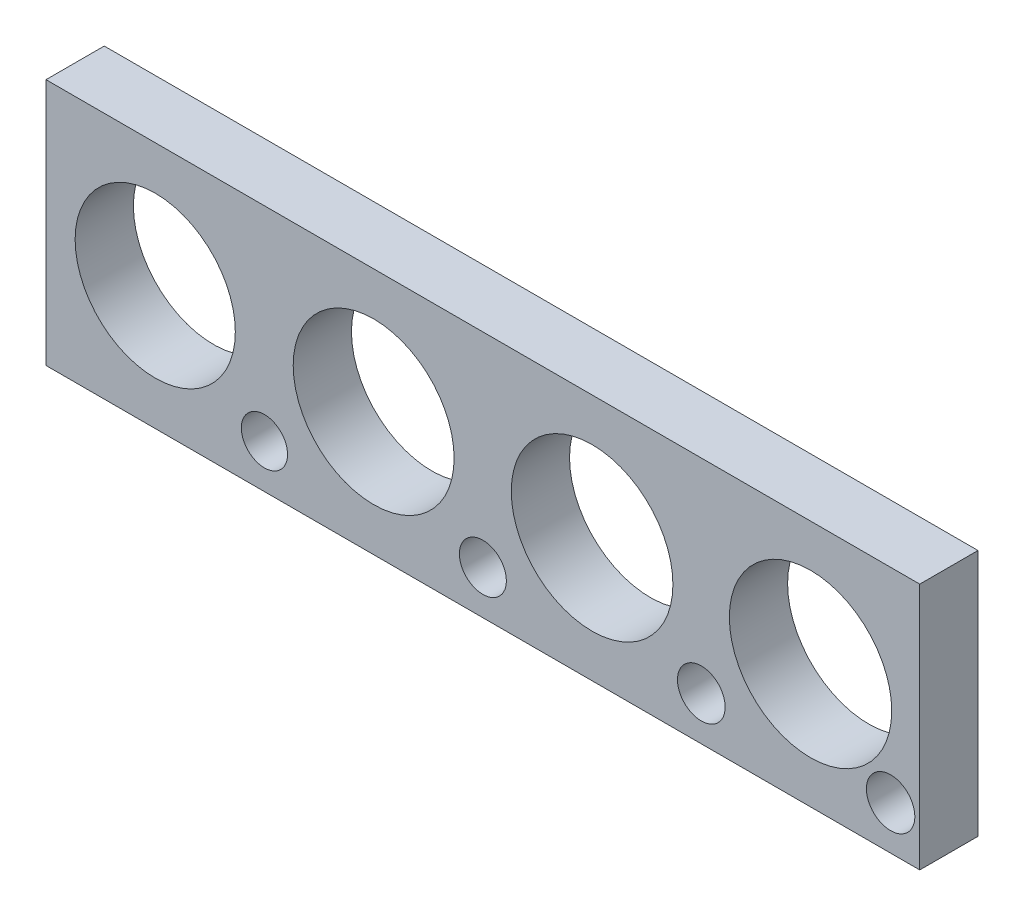
from build123d import *

# Parameters (mm, degrees)
COUPON_PLATE_PROFILE_W                     = 120
COUPON_PLATE_PROFILE_H                     = 34
COUPON_PLATE_DEPTH                         = 8
BEARING_FIT_TRIAL_THROUGH_START            = -1
BEARING_SEAT_TRIAL_22P0_22P1_22P2_22P3_R   = 11
BEARING_SEAT_TRIAL_22P0_22P1_22P2_22P3_R_2 = 11.05
BEARING_SEAT_TRIAL_22P0_22P1_22P2_22P3_R_3 = 11.1
BEARING_SEAT_TRIAL_22P0_22P1_22P2_22P3_R_4 = 11.15
BEARING_FIT_TRIAL_THROUGH_DEPTH            = 64.872887638
DOWEL_FIT_TRIAL_THROUGH_START              = -1
DOWEL_TRIAL_6P35_6P45_6P55_6P65_R          = 3.175
DOWEL_TRIAL_6P35_6P45_6P55_6P65_R_2        = 3.225
DOWEL_TRIAL_6P35_6P45_6P55_6P65_R_3        = 3.275
DOWEL_TRIAL_6P35_6P45_6P55_6P65_R_4        = 3.325
DOWEL_FIT_TRIAL_THROUGH_DEPTH              = 64.872887638


with BuildPart() as part:
    # Coupon_plate_profile → Coupon_plate (new body)
    with BuildSketch(Plane.XY):
        Rectangle(COUPON_PLATE_PROFILE_W, COUPON_PLATE_PROFILE_H)
    extrude(amount=COUPON_PLATE_DEPTH)

    # Bearing_seat_trial_22p0_22p1_22p2_22p3 → Bearing_fit_trial_through (cut, through all)
    with BuildSketch(Plane.XY.offset(BEARING_FIT_TRIAL_THROUGH_START)):
        with Locations((-45, 0)):
            Circle(BEARING_SEAT_TRIAL_22P0_22P1_22P2_22P3_R)
        with Locations((-15, 0)):
            Circle(BEARING_SEAT_TRIAL_22P0_22P1_22P2_22P3_R_2)
        with Locations((15, 0)):
            Circle(BEARING_SEAT_TRIAL_22P0_22P1_22P2_22P3_R_3)
        with Locations((45, 0)):
            Circle(BEARING_SEAT_TRIAL_22P0_22P1_22P2_22P3_R_4)
    extrude(amount=BEARING_FIT_TRIAL_THROUGH_DEPTH, mode=Mode.SUBTRACT)

    # Dowel_trial_6p35_6p45_6p55_6p65 → Dowel_fit_trial_through (cut, through all)
    with BuildSketch(Plane.XY.offset(DOWEL_FIT_TRIAL_THROUGH_START)):
        with Locations((-30, -11)):
            Circle(DOWEL_TRIAL_6P35_6P45_6P55_6P65_R)
        with Locations((0, -11)):
            Circle(DOWEL_TRIAL_6P35_6P45_6P55_6P65_R_2)
        with Locations((30, -11)):
            Circle(DOWEL_TRIAL_6P35_6P45_6P55_6P65_R_3)
        with Locations((56, -11)):
            Circle(DOWEL_TRIAL_6P35_6P45_6P55_6P65_R_4)
    extrude(amount=DOWEL_FIT_TRIAL_THROUGH_DEPTH, mode=Mode.SUBTRACT)


solid = part.part
